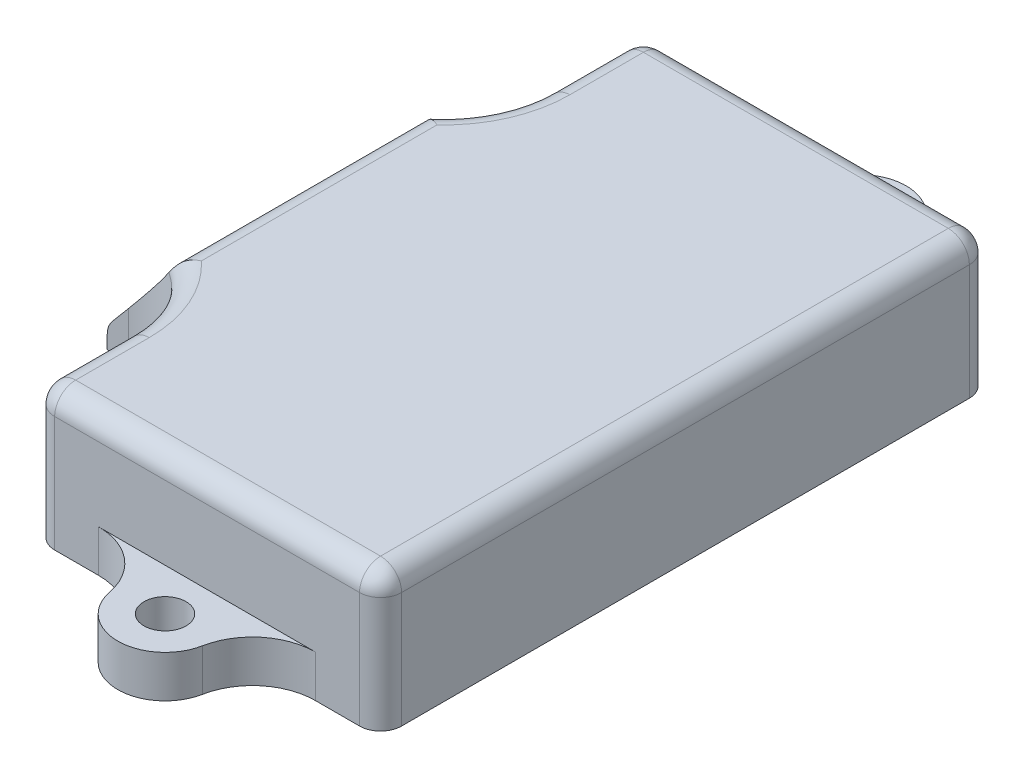
from build123d import *

# Parameters (mm, degrees)
BOSS_EXTRU_1_DEPTH      = 13
ESQUISSE2_R             = 2
BOSS_EXTRU_2_DEPTH      = 4
CHANFREIN2_SIZE         = 11
CHANFREIN2_SIZE2        = 9.230095943
COQUE1_DEPTH            = 0.908089297
COQUE1_2_DEPTH          = 1
COQUE1_START            = -39.287350261
COQUE1_3_OUTLINE_W      = 27
COQUE1_3_OUTLINE_H      = 9.091910703
COQUE1_3_DEPTH          = 52
COQUE1_START_2          = -20.287350261
COQUE1_4_DEPTH          = 14
CONG_4_R                = 10
ESQUISSE3_W             = 9
ESQUISSE3_H             = 1.5
ENL_V_MAT_EXTRU_1_DEPTH = 10
CONG_2_R                = 1
CONG_3_R                = 2


with BuildPart() as part:
    # Esquisse1 → Boss.-Extru.1 (new body)
    with BuildSketch(Plane(origin=(0, 0, 0), x_dir=(1, 0, 0), z_dir=(0, 1, 0))):
        Polygon((-21.708301388, 3.287350261), (-33.708301388, 3.287350261), (-33.708301388, 23.287350261), (-21.708301388, 23.287350261), (-21.708301388, 42.287350261), (11.291698612, 42.287350261), (11.291698612, -15.712649739), (-21.708301388, -15.712649739), align=None)
    extrude(amount=BOSS_EXTRU_1_DEPTH)

    # Esquisse2 → Boss.-Extru.2 (add)
    # profile 1 of 2: a face of its own
    with BuildSketch(Plane.XZ):
        with BuildLine():
            Line((-17.708301388, 12.712649739), (7.291698612, 12.712649739))
            Line((7.291698612, 12.712649739), (7.291698612, 15.712649739))
            Line((7.291698612, 15.712649739), (5.099462676, 15.712649739))
            ThreePointArc((5.099462676, 15.712649739), (1.282208614, 17.08354924), (-0.790688218, 20.569792596))
            ThreePointArc((-0.790688218, 20.569792596), (-5.208301388, 24.212649739), (-9.625914558, 20.569792596))
            ThreePointArc((-9.625914558, 20.569792596), (-11.698811391, 17.08354924), (-15.516065452, 15.712649739))
            Line((-15.516065452, 15.712649739), (-17.708301388, 15.712649739))
            Line((-17.708301388, 15.712649739), (-17.708301388, 12.712649739))
        make_face()
        with Locations(Location((-5.208301388, 19.712649739, 0), (0, 0, 270))):
            Circle(ESQUISSE2_R, mode=Mode.SUBTRACT)
    # profile 2 of 2: a face of its own
    with BuildSketch(Plane.XZ):
        with BuildLine():
            Line((-17.708301388, -42.287350261), (-17.708301388, -39.287350261))
            Line((-17.708301388, -39.287350261), (7.291698612, -39.287350261))
            Line((7.291698612, -39.287350261), (7.291698612, -42.287350261))
            Line((7.291698612, -42.287350261), (5.099462676, -42.287350261))
            ThreePointArc((5.099462676, -42.287350261), (1.282208614, -43.658249762), (-0.790688218, -47.144493118))
            ThreePointArc((-0.790688218, -47.144493118), (-5.208301388, -50.787350261), (-9.625914558, -47.144493118))
            ThreePointArc((-9.625914558, -47.144493118), (-11.698811391, -43.658249762), (-15.516065452, -42.287350261))
            Line((-15.516065452, -42.287350261), (-17.708301388, -42.287350261))
        make_face()
        with Locations(Location((-5.208301388, -46.287350261, 0), (0, 0, 90))):
            Circle(ESQUISSE2_R, mode=Mode.SUBTRACT)
    extrude(amount=-BOSS_EXTRU_2_DEPTH)

    # Chanfrein2
    chanfrein2_edges = [part.edges().sort_by_distance(p)[0] for p in [
        (-33.708301388, 13, -13.287350261),
    ]]
    chanfrein2_side = [part.faces().sort_by_distance(p)[0] for p in [
        (-33.708301388, 6.5, -13.287350261),
    ]]
    chamfer(chanfrein2_edges, length=CHANFREIN2_SIZE, length2=CHANFREIN2_SIZE2, reference=chanfrein2_side[0])

    # Coque1: read off the stored shape, not the designer's step
    # Coque1 outline → Coque1 (cut)
    with BuildSketch(Plane(origin=(0, 0, 0), x_dir=(1, 0, 0), z_dir=(0, 1, 0))):
        with BuildLine():
            Line((-18.708301388, 6.287350261), (-18.708301388, -12.712649739))
            Line((-18.708301388, -12.712649739), (-15.516065452, -12.712649739))
            ThreePointArc((-15.516065452, -12.712649739), (-11.668627484, -13.57648227), (-8.559754422, -16.002156165))
            ThreePointArc((-8.559754422, -16.002156165), (-5.208301388, -14.712649739), (-1.856848354, -16.002156165))
            ThreePointArc((-1.856848354, -16.002156165), (1.252024708, -13.57648227), (5.099462676, -12.712649739))
            Line((5.099462676, -12.712649739), (8.291698612, -12.712649739))
            Line((8.291698612, -12.712649739), (8.291698612, 39.287350261))
            Line((8.291698612, 39.287350261), (5.099462676, 39.287350261))
            ThreePointArc((5.099462676, 39.287350261), (1.252024708, 40.151182792), (-1.856848354, 42.576856687))
            ThreePointArc((-1.856848354, 42.576856687), (-5.208301388, 41.287350261), (-8.559754422, 42.576856687))
            ThreePointArc((-8.559754422, 42.576856687), (-11.668627484, 40.151182792), (-15.516065452, 39.287350261))
            Line((-15.516065452, 39.287350261), (-18.708301388, 39.287350261))
            Line((-18.708301388, 39.287350261), (-18.708301388, 20.287350261))
            Line((-18.708301388, 20.287350261), (-30.708301388, 20.287350261))
            Line((-30.708301388, 20.287350261), (-30.708301388, 6.287350261))
            Line((-30.708301388, 6.287350261), (-18.708301388, 6.287350261))
        make_face()
    extrude(amount=COQUE1_DEPTH, mode=Mode.SUBTRACT)

    # Coque1 2 outline → Coque1 2 (cut)
    with BuildSketch(Plane(origin=(0, 0, 0), x_dir=(1, 0, 0), z_dir=(0, 1, 0))):
        with BuildLine():
            Line((5.099462676, -12.712649739), (-15.516065452, -12.712649739))
            ThreePointArc((-15.516065452, -12.712649739), (-11.668627484, -13.57648227), (-8.559754422, -16.002156165))
            ThreePointArc((-8.559754422, -16.002156165), (-5.208301388, -14.712649739), (-1.856848354, -16.002156165))
            ThreePointArc((-1.856848354, -16.002156165), (1.252024708, -13.57648227), (5.099462676, -12.712649739))
        make_face()
        with BuildLine():
            Line((-15.516065452, 39.287350261), (5.099462676, 39.287350261))
            ThreePointArc((5.099462676, 39.287350261), (1.252024708, 40.151182792), (-1.856848354, 42.576856687))
            ThreePointArc((-1.856848354, 42.576856687), (-5.208301388, 41.287350261), (-8.559754422, 42.576856687))
            ThreePointArc((-8.559754422, 42.576856687), (-11.668627484, 40.151182792), (-15.516065452, 39.287350261))
        make_face()
    extrude(amount=COQUE1_2_DEPTH, mode=Mode.SUBTRACT)

    # Coque1 3 outline → Coque1 3 (cut)
    with BuildSketch(Plane.XY.offset(COQUE1_START)):
        with Locations((-5.208301388, 5.454044649)):
            Rectangle(COQUE1_3_OUTLINE_W, COQUE1_3_OUTLINE_H)
    extrude(amount=COQUE1_3_DEPTH, mode=Mode.SUBTRACT)

    # Coque1 4 outline → Coque1 4 (cut)
    with BuildSketch(Plane.XY.offset(COQUE1_START_2)):
        Polygon((-30.708301388, 0.908089297), (-18.708301388, 0.908089297), (-18.708301388, 10), (-23.079282471, 10), align=None)
    extrude(amount=COQUE1_4_DEPTH, mode=Mode.SUBTRACT)

    # Congé4
    # the kernel refuses this fillet: 10 mm, written as the material it adds along each edge
    with BuildSketch(Plane(origin=(-21.708301388, 0, -3.287350261), x_dir=(-1, 0, 0), z_dir=(0, 1, 0))) as cong_4_piece_1_section:
        with BuildLine():
            CenterArc((CONG_4_R, CONG_4_R), CONG_4_R, 180, 90)
            Line((0, CONG_4_R), (0, 0))
            Line((0, 0), (CONG_4_R, 0))
        make_face()
    cong_4_piece_1 = extrude(amount=13, mode=Mode.PRIVATE)
    cong_4_piece_1 = split(cong_4_piece_1, bisect_by=Plane(origin=(-29.734998207, 6.73519834, -3.287350261), z_dir=(0.7660444431189771, -0.6427876096865405, 0)), keep=Keep.TOP, mode=Mode.PRIVATE)
    add(cong_4_piece_1)
    with BuildSketch(Plane(origin=(-21.708301388, 0, -23.287350261), x_dir=(0, 0, -1), z_dir=(0, 1, 0))) as cong_4_piece_2_section:
        with BuildLine():
            CenterArc((CONG_4_R, CONG_4_R), CONG_4_R, 180, 90)
            Line((0, CONG_4_R), (0, 0))
            Line((0, 0), (CONG_4_R, 0))
        make_face()
    cong_4_piece_2 = extrude(amount=13, mode=Mode.PRIVATE)
    cong_4_piece_2 = split(cong_4_piece_2, bisect_by=Plane(origin=(-29.734998207, 6.73519834, -23.287350261), z_dir=(0.7660444431189771, -0.6427876096865405, 0)), keep=Keep.TOP, mode=Mode.PRIVATE)
    add(cong_4_piece_2)

    # Esquisse3 → Enlèv. mat.-Extru.1 (cut)
    with BuildSketch(Plane.ZY.offset(33.708301388)):
        with Locations((-13.287350261, 0.75)):
            Rectangle(ESQUISSE3_W, ESQUISSE3_H)
    extrude(amount=-ENL_V_MAT_EXTRU_1_DEPTH, mode=Mode.SUBTRACT)

    # Congé2
    cong_2_edges = [part.edges().sort_by_distance(p)[0] for p in [
        (-31.959965362, 1.5, -8.787350261),
        (-31.959965362, 1.5, -17.787350261),
    ]]
    fillet(cong_2_edges, radius=CONG_2_R)

    # Congé3
    # the kernel refuses this fillet: 2 mm, written as the material it takes off along each edge
    with BuildSketch(Plane(origin=(9.291698612, 11, -40.287350261), x_dir=(0, 0, -1), z_dir=(1, 0, 0))) as cong_3_piece_1_section:
        Polygon((0, 0), (CONG_3_R, 0), (CONG_3_R, CONG_3_R), (0, CONG_3_R), align=None)
    cong_3_piece_1 = extrude(amount=CONG_3_R, mode=Mode.PRIVATE)
    cong_3_piece_1 = cong_3_piece_1 - Plane(origin=(9.291698612, 11, -40.287350261), x_dir=(0, -0.7071067811865475, 0.7071067811865475), z_dir=(1, 0, 0)) * Sphere(CONG_3_R, mode=Mode.PRIVATE)
    add(cong_3_piece_1, mode=Mode.SUBTRACT)
    with BuildSketch(Plane(origin=(9.291698612, 11, 13.712649739), x_dir=(0, 1, 0), z_dir=(1, 0, 0))) as cong_3_piece_2_section:
        Polygon((0, 0), (CONG_3_R, 0), (CONG_3_R, CONG_3_R), (0, CONG_3_R), align=None)
    cong_3_piece_2 = extrude(amount=CONG_3_R, mode=Mode.PRIVATE)
    cong_3_piece_2 = cong_3_piece_2 - Plane(origin=(9.291698612, 11, 13.712649739), x_dir=(0, -0.7071067811865475, -0.7071067811865475), z_dir=(1, 0, 0)) * Sphere(CONG_3_R, mode=Mode.PRIVATE)
    add(cong_3_piece_2, mode=Mode.SUBTRACT)
    with BuildSketch(Plane(origin=(-19.708301388, 11, 13.712649739), x_dir=(-1, 0, 0), z_dir=(0, 1, 0))) as cong_3_piece_3_section:
        Polygon((0, 0), (CONG_3_R, 0), (CONG_3_R, CONG_3_R), (0, CONG_3_R), align=None)
    cong_3_piece_3 = extrude(amount=CONG_3_R, mode=Mode.PRIVATE)
    cong_3_piece_3 = cong_3_piece_3 - Plane(origin=(-19.708301388, 11, 13.712649739), x_dir=(0.7071067811865475, 0, -0.7071067811865475), z_dir=(0, 1, 0)) * Sphere(CONG_3_R, mode=Mode.PRIVATE)
    add(cong_3_piece_3, mode=Mode.SUBTRACT)
    with BuildSketch(Plane(origin=(-19.708301388, 11, -40.287350261), x_dir=(-1, 0, 0), z_dir=(0, 0, -1))) as cong_3_piece_4_section:
        Polygon((0, 0), (CONG_3_R, 0), (CONG_3_R, CONG_3_R), (0, CONG_3_R), align=None)
    cong_3_piece_4 = extrude(amount=CONG_3_R, mode=Mode.PRIVATE)
    cong_3_piece_4 = cong_3_piece_4 - Plane(origin=(-19.708301388, 11, -40.287350261), x_dir=(0.7071067811865475, -0.7071067811865475, 0), z_dir=(0, 0, -1)) * Sphere(CONG_3_R, mode=Mode.PRIVATE)
    add(cong_3_piece_4, mode=Mode.SUBTRACT)
    with BuildSketch(Plane(origin=(11.291698612, -5, -42.287350261), x_dir=(0, 0, 1), z_dir=(0, 1, 0)), Plane(origin=(11.291698612, -5, 15.712649739), x_dir=(-1, 0, 0), z_dir=(0, 1, 0)), Plane(origin=(-21.708301388, -5, 15.712649739), x_dir=(0, 0, -1), z_dir=(0, 1, 0)), Plane(origin=(-21.708301388, -5, -42.287350261), x_dir=(1, 0, 0), z_dir=(0, 1, 0))) as cong_3_piece_5:
        with BuildLine():
            CenterArc((CONG_3_R, -CONG_3_R), CONG_3_R, 90, 90)
            Line((0, -CONG_3_R), (0, 0))
            Line((0, 0), (CONG_3_R, 0))
        make_face()
    extrude(amount=16, mode=Mode.SUBTRACT)
    with BuildSketch(Plane(origin=(11.291698612, 13, -40.287350261), x_dir=(0, -1, 0), z_dir=(0, 0, 1))) as cong_3_piece_6:
        with BuildLine():
            CenterArc((CONG_3_R, -CONG_3_R), CONG_3_R, 90, 90)
            Line((0, -CONG_3_R), (0, 0))
            Line((0, 0), (CONG_3_R, 0))
        make_face()
    extrude(amount=54, mode=Mode.SUBTRACT)
    with BuildSketch(Plane(origin=(9.291698612, 13, 15.712649739), x_dir=(0, -1, 0), z_dir=(-1, 0, 0)), Plane(origin=(-19.708301388, 13, -42.287350261), x_dir=(0, -1, 0), z_dir=(1, 0, 0))) as cong_3_piece_7:
        with BuildLine():
            CenterArc((CONG_3_R, -CONG_3_R), CONG_3_R, 90, 90)
            Line((0, -CONG_3_R), (0, 0))
            Line((0, 0), (CONG_3_R, 0))
        make_face()
    extrude(amount=29, mode=Mode.SUBTRACT)
    with BuildSketch(Plane(origin=(-21.708301388, 13, 13.712649739), x_dir=(0, -1, 0), z_dir=(0, 0, -1)), Plane(origin=(-21.708301388, 13, -33.287350261), x_dir=(0, -1, 0), z_dir=(0, 0, -1))) as cong_3_piece_8:
        with BuildLine():
            CenterArc((CONG_3_R, -CONG_3_R), CONG_3_R, 90, 90)
            Line((0, -CONG_3_R), (0, 0))
            Line((0, 0), (CONG_3_R, 0))
        make_face()
    extrude(amount=7, mode=Mode.SUBTRACT)
    with BuildSketch(Plane(origin=(-33.708301388, 2, -1.46749909), x_dir=(0, -1, 0), z_dir=(0, 0, -1))) as cong_3_piece_9:
        with BuildLine():
            CenterArc((CONG_3_R * 0.363970234266, -CONG_3_R), CONG_3_R, 90, 40)
            Line((-CONG_3_R * 0.27881737542, -CONG_3_R * 0.233955556881), (0, 0))
            Line((0, 0), (CONG_3_R * 0.363970234266, 0))
        make_face()
    extrude(amount=23.639702343, mode=Mode.SUBTRACT)
    with BuildSketch(Plane(origin=(-24.478205445, 13, -28.710508665), x_dir=(-0.642787609686802, -0.7660444431187577, 0), z_dir=(0, 0, 1))) as cong_3_piece_10:
        with BuildLine():
            CenterArc((CONG_3_R * 0.466307658155, CONG_3_R), CONG_3_R, 220, 50)
            Line((-CONG_3_R * 0.299736784964, CONG_3_R * 0.357212390313), (0, 0))
            Line((0, 0), (CONG_3_R * 0.466307658155, 0))
        make_face()
    extrude(amount=30.846316809, mode=Mode.SUBTRACT)
    with BuildSketch(Plane(origin=(-31.708301388, 13, 6.712649739), x_dir=(1, 0, 0), z_dir=(0, 0, 1))) as cong_3_piece_11:
        with BuildLine():
            CenterArc((10 + CONG_3_R, -CONG_3_R), CONG_3_R, 90, 90)
            Line((10 + CONG_3_R, 0), (10, 0))
            Line((10, 0), (10, -CONG_3_R))
        make_face()
    revolve(axis=Axis((-31.708301388, 13, 6.712649739), (0, 1, 0)), revolution_arc=72.347081519, mode=Mode.SUBTRACT)
    with BuildSketch(Plane(origin=(-31.708301388, 13, -33.287350261), x_dir=(0.3032501302035069, 0, 0.9529109919250359), z_dir=(-0.9529109919250359, 0, 0.3032501302035069))) as cong_3_piece_12:
        with BuildLine():
            CenterArc((10 + CONG_3_R, -CONG_3_R), CONG_3_R, 90, 90)
            Line((10 + CONG_3_R, 0), (10, 0))
            Line((10, 0), (10, -CONG_3_R))
        make_face()
    revolve(axis=Axis((-31.708301388, 13, -33.287350261), (0, 1, 0)), revolution_arc=72.347081519, mode=Mode.SUBTRACT)


solid = part.part
